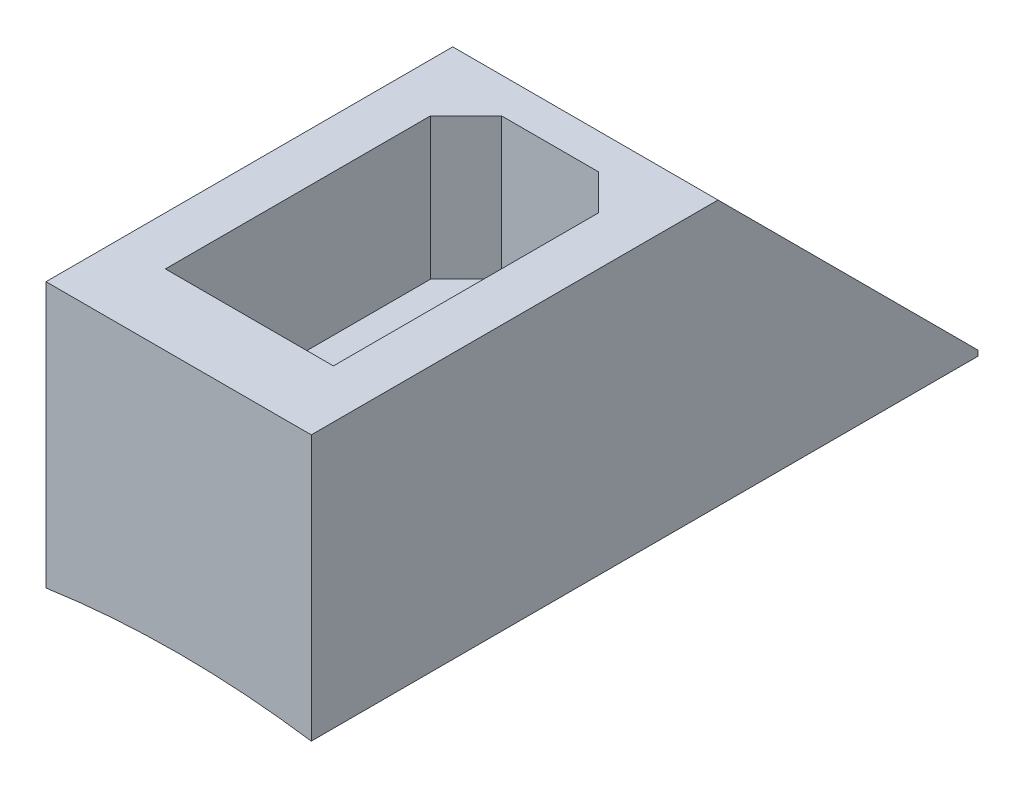
from build123d import *
from build123d.topology import SkipClean

# Parameters (mm, degrees)
SKETCH1_W               = 15
SKETCH1_H               = 23.93877551
BOSS_EXTRUDE1_DEPTH     = 25
CUT_EXTRUDE1_DEPTH      = 25
CUT_EXTRUDE2_DEPTH      = 33.787192622
CUT_EXTRUDE2_DEPTH_BACK = 33.787192622
SKETCH3_R               = 2.75
SKETCH4_W               = 9.5
SKETCH4_H               = 17
CUT_EXTRUDE3_DEPTH      = 8
CHAMFER1_SIZE           = 2
BOSS_EXTRUDE2_DEPTH     = 12.7
CHAMFER2_START          = 15.513056934
CHAMFER2_OUTLINE_W      = 15
CHAMFER2_OUTLINE_H      = 24
CHAMFER2_DEPTH          = 11.486943066


with BuildPart() as part:
    # Sketch1 → Boss-Extrude1 (new body)
    with BuildSketch(Plane.XY):
        with Locations((7.5, 11.969387755)):
            Rectangle(SKETCH1_W, SKETCH1_H)
    extrude(amount=BOSS_EXTRUDE1_DEPTH)

    # Sketch2 → Cut-Extrude1 (cut)
    with BuildSketch(Plane.XY.offset(25)):
        with BuildLine():
            Line((0, 8.93877551), (0, 0))
            Line((0, 0), (15, 0))
            Line((15, 0), (15, 8.93877551))
            ThreePointArc((15, 8.93877551), (7.5, 9.487151408), (0, 8.93877551))
        make_face()
    extrude(amount=-CUT_EXTRUDE1_DEPTH, mode=Mode.SUBTRACT)

    # Sketch3 → Cut-Extrude2 (cut, two sides: drawn at the far end of the back side and taken through both)
    with BuildSketch(Plane(origin=(0, 23.93877551, 0), x_dir=(1, 0, 0), z_dir=(0, 1, 0)).offset(-CUT_EXTRUDE2_DEPTH_BACK)):
        with Locations(Location((7.5, -8.825, 0), (0, 0, 270))):
            Circle(SKETCH3_R)
        with Locations(Location((7.5, -16.175, 0), (0, 0, 270))):
            Circle(SKETCH3_R)
    extrude(amount=CUT_EXTRUDE2_DEPTH + CUT_EXTRUDE2_DEPTH_BACK, mode=Mode.SUBTRACT)

    # Sketch4 → Cut-Extrude3 (cut)
    with BuildSketch(Plane(origin=(0, 23.93877551, 0), x_dir=(1, 0, 0), z_dir=(0, 1, 0))):
        with Locations((7.5, -12.5)):
            Rectangle(SKETCH4_W, SKETCH4_H)
    extrude(amount=-CUT_EXTRUDE3_DEPTH, mode=Mode.SUBTRACT)

    # Chamfer1
    chamfer1_edges = [part.edges().sort_by_distance(p)[0] for p in [
        (2.75, 19.93877551, 4),
        (12.25, 19.93877551, 4),
    ]]
    chamfer(chamfer1_edges, length=CHAMFER1_SIZE)

    # Sketch5 → Boss-Extrude2 (add)
    with SkipClean():  # the faces are left unmerged after this step: merging them gives an invalid solid
        with BuildSketch(Plane(origin=(0, 0, 0), x_dir=(-1, 0, 0), z_dir=(0, 0, -1))):
            with BuildLine():
                Line((-15, 23.93877551), (0, 23.93877551))
                Line((0, 23.93877551), (0, 8.93877551))
                ThreePointArc((0, 8.93877551), (-7.5, 9.487151408), (-15, 8.93877551))
                Line((-15, 8.93877551), (-15, 23.93877551))
            make_face()
        extrude(amount=BOSS_EXTRUDE2_DEPTH)

    # Chamfer2: read off the stored shape, not the designer's step
    # Chamfer2 outline → Chamfer2 (cut)
    with BuildSketch(Plane(origin=(0, 0, 0), x_dir=(1, 0, 0), z_dir=(0, 0.707106781186544, -0.707106781186551)).offset(CHAMFER2_START)):
        with Locations((7.5, -8)):
            Rectangle(CHAMFER2_OUTLINE_W, CHAMFER2_OUTLINE_H)
    extrude(amount=CHAMFER2_DEPTH, mode=Mode.SUBTRACT)


solid = part.part
